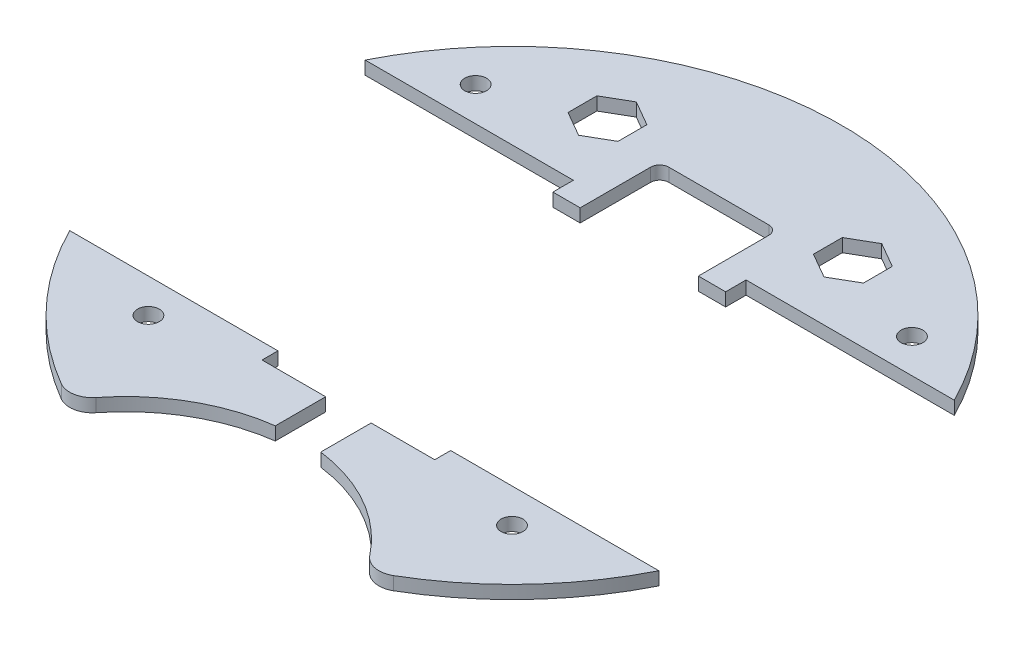
from build123d import *

# Parameters (mm, degrees)
BOSS_EXTRUDE1_DEPTH  = 2.9
SOLENOID_PLACEMENT_W = 38
SOLENOID_PLACEMENT_H = 64
CUT_EXTRUDE1_DEPTH   = 103.571487266
CUT_EXTRUDE4_DEPTH   = 103.571487266
CUT_EXTRUDE5_DEPTH   = 103.571487266
SKETCH6_R            = 2.4
CUT_EXTRUDE6_DEPTH   = 103.571487266
CUT_EXTRUDE3_DEPTH   = 103.571487266
SKETCH7_W            = 10
SKETCH7_H            = 50
CUT_EXTRUDE7_DEPTH   = 98.286484159


with BuildPart() as part:
    # Sketch1 → Boss-Extrude1 (new body)
    with BuildSketch(Plane(origin=(0, 0, 0), x_dir=(1, 0, 0), z_dir=(0, 1, 0))):
        with BuildLine():
            ThreePointArc((36.543377003, -62.616544118), (0, 72.5), (-36.543377003, -62.616544118))
            ThreePointArc((-36.543377003, -62.616544118), (-33.085954668, -63.20954405), (-30.089832649, -61.38507948))
            ThreePointArc((-30.089832649, -61.38507948), (0, -46.75), (30.089832649, -61.38507948))
            ThreePointArc((30.089832649, -61.38507948), (33.085954668, -63.20954405), (36.543377003, -62.616544118))
        make_face()
    extrude(amount=BOSS_EXTRUDE1_DEPTH)

    # solenoid placement → Cut-Extrude1 (cut, through all)
    with BuildSketch(Plane(origin=(0, 2.9, 0), x_dir=(1, 0, 0), z_dir=(0, 1, 0))):
        with Locations((0, -4)):
            Rectangle(SOLENOID_PLACEMENT_W, SOLENOID_PLACEMENT_H)
    extrude(amount=-CUT_EXTRUDE1_DEPTH, mode=Mode.SUBTRACT)

    # Sketch4 → Cut-Extrude4 (cut, through all)
    with BuildSketch(Plane(origin=(0, 2.9, 0), x_dir=(1, 0, 0), z_dir=(0, 1, 0))):
        with BuildLine():
            Line((-13, 28), (13, 28))
            Line((13, 28), (13, 43.5))
            ThreePointArc((13, 43.5), (12.414213562, 44.914213562), (11, 45.5))
            Line((11, 45.5), (-11, 45.5))
            ThreePointArc((-11, 45.5), (-12.414213562, 44.914213562), (-13, 43.5))
            Line((-13, 43.5), (-13, 28))
        make_face()
    extrude(amount=-CUT_EXTRUDE4_DEPTH, mode=Mode.SUBTRACT)

    # Sketch5 → Cut-Extrude5 (cut, through all)
    with BuildSketch(Plane(origin=(0, 2.9, 0), x_dir=(1, 0, 0), z_dir=(0, 1, 0))):
        Polygon((-21.5, 51.175426481), (-27, 54.350852961), (-32.5, 51.175426481), (-32.5, 44.824573519), (-27, 41.649147039), (-21.5, 44.824573519), align=None)
        Polygon((21.5, 44.824573519), (21.5, 51.175426481), (27, 54.350852961), (32.5, 51.175426481), (32.5, 44.824573519), (27, 41.649147039), align=None)
    extrude(amount=-CUT_EXTRUDE5_DEPTH, mode=Mode.SUBTRACT)

    # Sketch6 → Cut-Extrude6 (cut, through all)
    with BuildSketch(Plane(origin=(0, 2.9, 0), x_dir=(1, 0, 0), z_dir=(0, 1, 0))):
        with Locations((40, -40)):
            Circle(SKETCH6_R)
        with Locations((-40, -40)):
            Circle(SKETCH6_R)
        with Locations((48, 40)):
            Circle(SKETCH6_R)
        with Locations((-48, 40)):
            Circle(SKETCH6_R)
    extrude(amount=-CUT_EXTRUDE6_DEPTH, mode=Mode.SUBTRACT)

    # Sketch3 → Cut-Extrude3 (cut, through all)
    with BuildSketch(Plane(origin=(0, 2.9, 0), x_dir=(1, 0, 0), z_dir=(0, 1, 0))):
        Polygon((-19, 28), (-19, 32.5), (-72.5, 32.5), (-72.5, -32.5), (72.5, -32.5), (72.5, 32.5), (19, 32.5), (19, 28), align=None)
    extrude(amount=-CUT_EXTRUDE3_DEPTH, mode=Mode.SUBTRACT)


with BuildPart() as cut_extrude3_piece_1:
    # of the separate pieces the step leaves, piece 1, a body of its own (cut_extrude3_pieces)
    add(part.part.solids().sort_by_distance((64.807406984, 0, -32.5))[0])


with BuildPart() as cut_extrude3_piece_2:
    # of the separate pieces the step leaves, piece 2, a body of its own (cut_extrude3_pieces)
    add(part.part.solids().sort_by_distance((-36.543377003, 0, 62.616544118))[0])

    # Sketch7 → Cut-Extrude7 (cut, through all)
    with BuildSketch(Plane(origin=(0, 2.9, 0), x_dir=(1, 0, 0), z_dir=(0, 1, 0))):
        with Locations((0, -25)):
            Rectangle(SKETCH7_W, SKETCH7_H)
    extrude(amount=-CUT_EXTRUDE7_DEPTH, mode=Mode.SUBTRACT)


with BuildPart() as cut_extrude7_piece_1:
    # of the separate pieces the step leaves, piece 1, a body of its own (cut_extrude7_pieces)
    add(cut_extrude3_piece_2.part.solids().sort_by_distance((-36.543377003, 0, 62.616544118))[0])


with BuildPart() as cut_extrude7_piece_2:
    # of the separate pieces the step leaves, piece 2, a body of its own (cut_extrude7_pieces)
    add(cut_extrude3_piece_2.part.solids().sort_by_distance((5, 0, 47.078205475))[0])


solid = Compound([cut_extrude3_piece_1.part, cut_extrude7_piece_1.part, cut_extrude7_piece_2.part])
